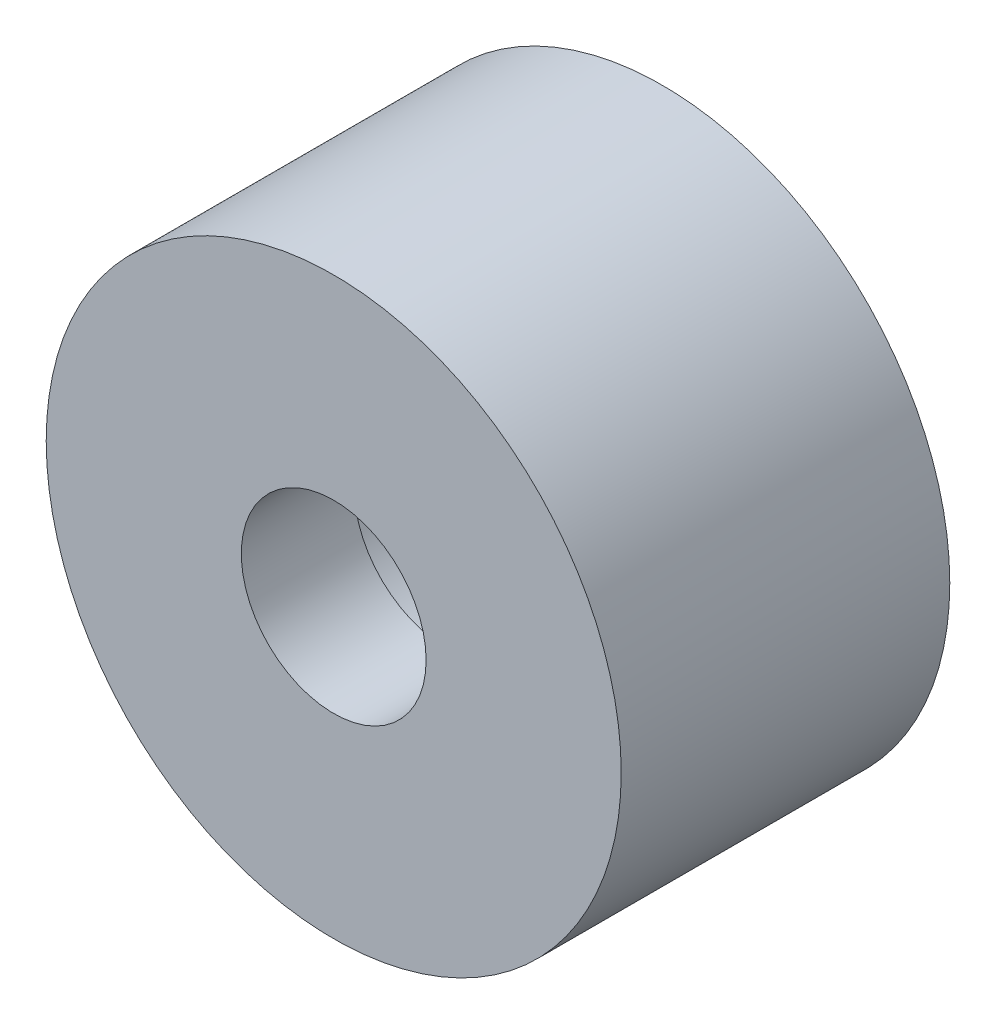
from build123d import *

# Parameters (mm, degrees)
SZKIC1_W                    = 32
SZKIC1_H                    = 28
SZKIC3_R                    = 21
DODANIE_WYCI_GNI_CIE1_DEPTH = 14


# Read off the part's stored shape, not the designer's step: Usuń ścianę1
with BuildPart() as part:
    # Szkic1 → Obrót1 (revolve)
    with BuildSketch(Plane(origin=(0, 0, 0), x_dir=(0, 0, -1), z_dir=(1, 0, 0)), mode=Mode.PRIVATE) as obr_t1_sk:
        with Locations((-16, 14)):
            Rectangle(SZKIC1_W, SZKIC1_H)
    revolve(obr_t1_sk.sketch.rotate(Axis((0, 0, 0), (0, 0, 1)), 270), axis=Axis((0, 0, 0), (0, 0, 1)))

    # Szkic2 → Wycięcie-obrót1 (revolve, cut)
    with BuildSketch(Plane(origin=(0, 0, 0), x_dir=(0, 0, -1), z_dir=(1, 0, 0)), mode=Mode.PRIVATE) as wyci_cie_obr_t1_sk:
        Polygon((-32, 0), (-32, 9), (-21, 9), (-21, 13), (0, 13), (0, 0), align=None)
    revolve(wyci_cie_obr_t1_sk.sketch.rotate(Axis((0, 0, 0), (0, 0, 1)), 270), axis=Axis((0, 0, 0), (0, 0, 1)), mode=Mode.SUBTRACT)


with BuildPart() as body_2:
    # Szkic3 → Dodanie-wyciągnięcie1 (new body)
    with BuildSketch(Plane(origin=(0, 0, 0), x_dir=(0, 0, -1), z_dir=(1, 0, 0))):
        Circle(SZKIC3_R)
    extrude(amount=DODANIE_WYCI_GNI_CIE1_DEPTH)


solid = part.part
